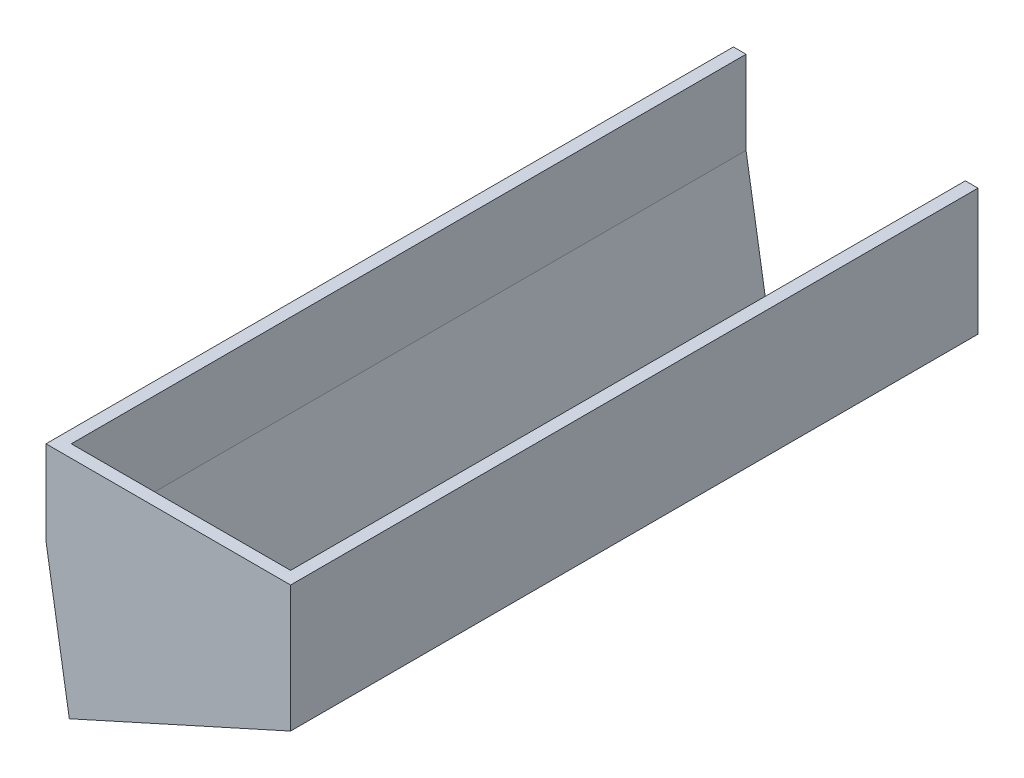
from build123d import *

# Parameters (mm, degrees)
BOSS_EXTRUDE1_DEPTH = 160
SKETCH2_W           = 45
SKETCH2_H           = 42
CUT_EXTRUDE1_DEPTH  = 178.508105134
BOSS_EXTRUDE2_DEPTH = 3


with BuildPart() as part:
    # Sketch1 → Boss-Extrude1 (new body)
    with BuildSketch(Plane.XY):
        Polygon((0, 0), (0, -19.755733184), (4.853161861, -49.360577719), (52, -28.06328686), (52, 0), (55, 0), (55, -30), (2.525153775, -53.704072361), (-3, -20), (-3, 0), align=None)
    extrude(amount=BOSS_EXTRUDE1_DEPTH)

    # Sketch2 → Cut-Extrude1 (cut, through all)
    with BuildSketch(Plane(origin=(0, 0, 0), x_dir=(1, 0, 0), z_dir=(0, 1, 0))):
        with Locations((27.353161861, -29)):
            Rectangle(SKETCH2_W, SKETCH2_H)
        with Locations((27.353161861, -84)):
            Rectangle(SKETCH2_W, SKETCH2_H)
        with Locations((27.353161861, -139)):
            Rectangle(SKETCH2_W, SKETCH2_H)
    extrude(amount=-CUT_EXTRUDE1_DEPTH, mode=Mode.SUBTRACT)

    # Sketch3 → Boss-Extrude2 (add)
    with BuildSketch(Plane.XY.offset(160)):
        Polygon((-3, 0), (55, 0), (55, -30), (4.853161861, -52.652458567), (2.525153775, -53.704072361), (-3, -20), align=None)
    extrude(amount=BOSS_EXTRUDE2_DEPTH)


solid = part.part
